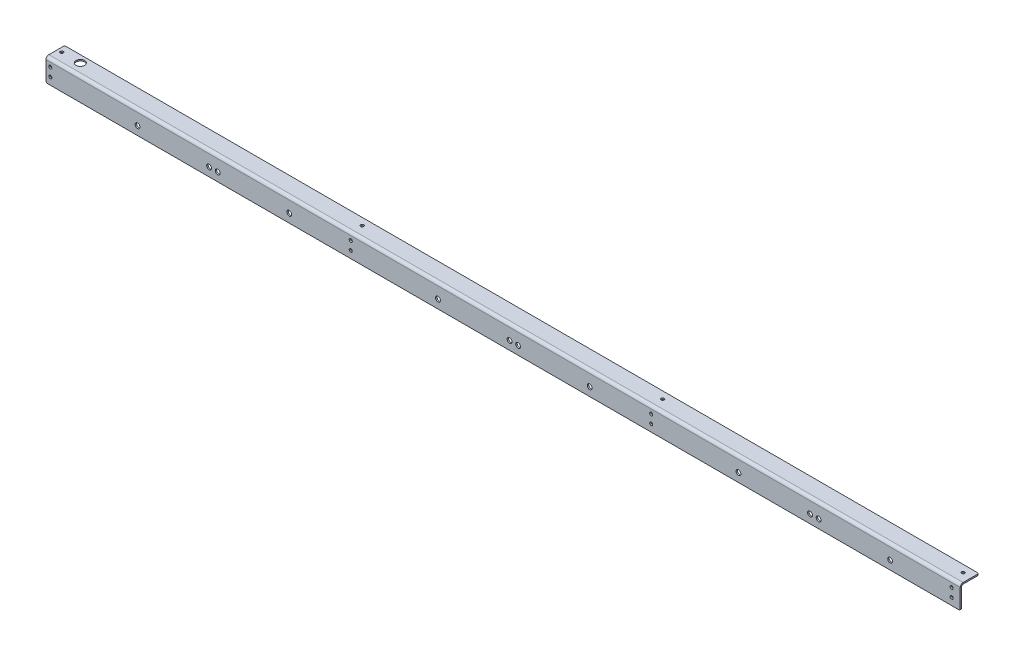
from build123d import *

# Parameters (mm, degrees)
BASE_FLANGE1_DEPTH = 2028.825
SKETCH2_R          = 5.3578125
SKETCH2_R_2        = 3.429
CUT_EXTRUDE1_DEPTH = 2030.818496966
SKETCH3_R          = 3.429
SKETCH3_R_2        = 9.525
CUT_EXTRUDE2_DEPTH = 2030.880574381
FILLET1_R          = 3.175


# Sheet-metal steps are written as plain solids
with BuildPart() as part:
    # Sketch1 → Base-Flange1 (new body)
    with BuildSketch(Plane(origin=(0, 0, 0), x_dir=(0, 0, -1), z_dir=(1, 0, 0))):
        with BuildLine():
            Line((41.275, 0), (6.35, 0))
            ThreePointArc((6.35, 0), (1.859871939, -1.859871939), (0, -6.35))
            Line((0, -6.35), (0, -50.8))
            Line((0, -50.8), (3.175, -50.8))
            Line((3.175, -50.8), (3.175, -6.35))
            ThreePointArc((3.175, -6.35), (4.10493597, -4.10493597), (6.35, -3.175))
            Line((6.35, -3.175), (41.275, -3.175))
            Line((41.275, -3.175), (41.275, 0))
        make_face()
    extrude(amount=BASE_FLANGE1_DEPTH)

    # Sketch2 → Cut-Extrude1 (cut, through all)
    with BuildSketch(Plane(origin=(0, 0, -3.175), x_dir=(-1, 0, 0), z_dir=(0, 0, -1))):
        with Locations((-1873.25, -31.75)):
            Circle(SKETCH2_R)
        with Locations((-1714.5, -31.75)):
            Circle(SKETCH2_R)
        with Locations((-1695.45, -31.75)):
            Circle(SKETCH2_R)
        with Locations((-1536.7, -31.75)):
            Circle(SKETCH2_R)
        with Locations((-1206.5, -31.75)):
            Circle(SKETCH2_R)
        with Locations((-1047.75, -31.75)):
            Circle(SKETCH2_R)
        with Locations((-1028.7, -31.75)):
            Circle(SKETCH2_R)
        with Locations((-869.95, -31.75)):
            Circle(SKETCH2_R)
        with Locations((-539.75, -31.75)):
            Circle(SKETCH2_R)
        with Locations((-381, -31.75)):
            Circle(SKETCH2_R)
        with Locations((-361.95, -31.75)):
            Circle(SKETCH2_R)
        with Locations((-203.2, -31.75)):
            Circle(SKETCH2_R)
        with Locations((-9.525, -15.875)):
            Circle(SKETCH2_R_2)
        with Locations((-9.525, -34.925)):
            Circle(SKETCH2_R_2)
        with Locations((-676.275, -34.925)):
            Circle(SKETCH2_R_2)
        with Locations((-676.275, -15.875)):
            Circle(SKETCH2_R_2)
        with Locations((-1343.025, -34.925)):
            Circle(SKETCH2_R_2)
        with Locations((-1343.025, -15.875)):
            Circle(SKETCH2_R_2)
        with Locations((-2009.775, -34.925)):
            Circle(SKETCH2_R_2)
        with Locations((-2009.775, -15.875)):
            Circle(SKETCH2_R_2)
    extrude(amount=-CUT_EXTRUDE1_DEPTH, mode=Mode.SUBTRACT)

    # Sketch3 → Cut-Extrude2 (cut, through all)
    with BuildSketch(Plane(origin=(0, 0, 0), x_dir=(1, 0, 0), z_dir=(0, 1, 0))):
        with Locations(Location((2009.775, 25.4, 0), (0, 0, 270))):
            Circle(SKETCH3_R)
        with Locations(Location((1343.025, 25.4, 0), (0, 0, 270))):
            Circle(SKETCH3_R)
        with Locations(Location((676.275, 25.4, 0), (0, 0, 270))):
            Circle(SKETCH3_R)
        with Locations(Location((9.525, 25.4, 0), (0, 0, 270))):
            Circle(SKETCH3_R)
        with Locations(Location((50.8, 25.4, 0), (0, 0, 270))):
            Circle(SKETCH3_R_2)
    extrude(amount=-CUT_EXTRUDE2_DEPTH, mode=Mode.SUBTRACT)

    # Fillet1
    fillet1_edges = [part.edges().sort_by_distance(p)[0] for p in [
        (2028.825, -1.5875, -41.275),
        (0, -1.5875, -41.275),
        (2028.825, -50.8, -1.5875),
        (0, -50.8, -1.5875),
    ]]
    fillet(fillet1_edges, radius=FILLET1_R)


solid = part.part
